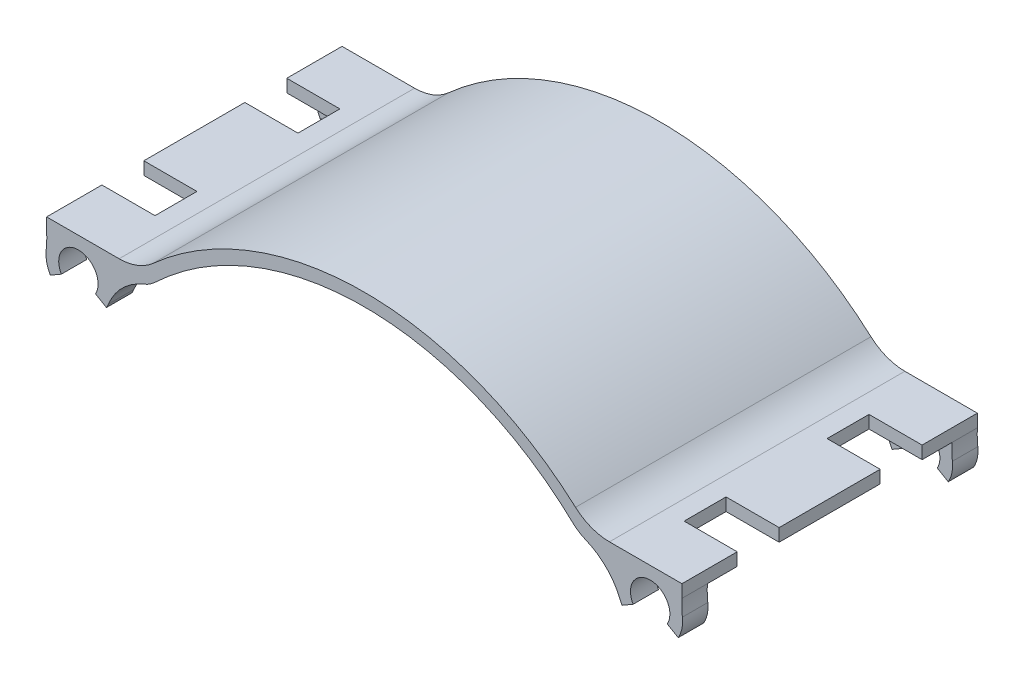
from build123d import *

# Parameters (mm, degrees)
SKETCH3_R             = 5.1
SKETCH3_R_2           = 3.1
BOSS_EXTRUDE2_DEPTH   = 4
BOSS_EXTRUDE2_2_DEPTH = 4
CUT_EXTRUDE1_DEPTH    = 4
BOSS_EXTRUDE3_START   = -23.25
BOSS_EXTRUDE3_DEPTH   = 46.5
SKETCH7_W             = 9.658407056
SKETCH7_H             = 6.6
CUT_EXTRUDE2_DEPTH    = 2
FILLET1_R             = 8
FILLET2_R             = 6
FILLET3_R             = 10
FILLET4_R             = 15


with BuildPart() as part:
    # Sketch3 → Boss-Extrude2 (new body)
    with BuildSketch(Plane.XY):
        with Locations((-116.546102611, -10.445456474)):
            Circle(SKETCH3_R)
        with Locations((-116.546102611, -10.445456474)):
            Circle(SKETCH3_R_2, mode=Mode.SUBTRACT)
    extrude(amount=BOSS_EXTRUDE2_DEPTH)


with BuildPart() as body_2:
    # Sketch3 → Boss-Extrude2 2 (new body)
    with BuildSketch(Plane.XY):
        with Locations(Location((-26.546102611, -10.445456474, 0), (0, 0, 180))):
            Circle(SKETCH3_R)
        with Locations(Location((-26.546102611, -10.445456474, 0), (0, 0, 180))):
            Circle(SKETCH3_R_2, mode=Mode.SUBTRACT)
    extrude(amount=BOSS_EXTRUDE2_2_DEPTH)


with BuildPart() as cut_extrude1_tool:
    # Sketch4 → Cut-Extrude1 (new body)
    with BuildSketch(Plane.XY.offset(4)):
        Polygon((-116.546102611, -10.445456474), (-134.15945469, -20.614530038), (-98.932750532, -20.614530038), align=None)
        Polygon((-26.546102611, -10.445456474), (-8.932750532, -20.614530038), (-44.15945469, -20.614530038), align=None)
    extrude(amount=-CUT_EXTRUDE1_DEPTH)


with BuildPart() as part_1:
    add(part.part)

    # Cut-Extrude1: cut by cut_extrude1_tool
    add(cut_extrude1_tool.part, mode=Mode.SUBTRACT)


with BuildPart() as body_2_1:
    add(body_2.part)

    # Cut-Extrude1: cut by cut_extrude1_tool
    add(cut_extrude1_tool.part, mode=Mode.SUBTRACT)


with BuildPart() as body_3:
    # Mirror2: mirrored copy
    add(part_1.part.mirror(Plane.XY.offset(23.25)))


with BuildPart() as body_4:
    # Mirror2 2: mirrored copy
    add(body_2_1.part.mirror(Plane.XY.offset(23.25)))


with BuildPart() as part_2:
    add(part_1.part)

    add(body_2_1.part)  # Boss-Extrude3 merges body 2

    add(body_3.part)  # Boss-Extrude3 merges body 3

    add(body_4.part)  # Boss-Extrude3 merges body 4
    # Sketch6 → Boss-Extrude3 (add)
    with BuildSketch(Plane.XY.offset(23.25).offset(BOSS_EXTRUDE3_START)):
        with BuildLine():
            Line((-121.546102611, -7.345456474), (-106.100588572, -7.345456474))
            ThreePointArc((-106.100588572, -7.345456474), (-71.546102611, 7.404543526), (-36.99161665, -7.345456474))
            Line((-36.99161665, -7.345456474), (-21.546102611, -7.345456474))
            Line((-21.546102611, -7.345456474), (-21.546102611, -5.345456474))
            Line((-21.546102611, -5.345456474), (-36.148186006, -5.345456474))
            ThreePointArc((-36.148186006, -5.345456474), (-71.546102611, 9.404543526), (-106.944019216, -5.345456474))
            Line((-106.944019216, -5.345456474), (-121.546102611, -5.345456474))
            Line((-121.546102611, -5.345456474), (-121.546102611, -7.345456474))
        make_face()
    extrude(amount=BOSS_EXTRUDE3_DEPTH)

    # Sketch7 → Cut-Extrude2 (cut)
    with BuildSketch(Plane(origin=(0, -5.345456474, 0), x_dir=(1, 0, 0), z_dir=(0, 1, 0))):
        with Locations((-118.016899083, -12)):
            Rectangle(SKETCH7_W, SKETCH7_H)
        with Locations((-118.016899083, -34.5)):
            Rectangle(SKETCH7_W, SKETCH7_H)
        with Locations((-25.075306139, -34.5)):
            Rectangle(SKETCH7_W, SKETCH7_H)
        with Locations((-25.075306139, -12)):
            Rectangle(SKETCH7_W, SKETCH7_H)
    extrude(amount=-CUT_EXTRUDE2_DEPTH, mode=Mode.SUBTRACT)

    # Fillet1
    fillet1_edges = [part_2.edges().sort_by_distance(p)[0] for p in [
        (-36.148186006, -5.345456474, 23.25),
        (-106.944019216, -5.345456474, 23.25),
    ]]
    fillet(fillet1_edges, radius=FILLET1_R)

    # Fillet2
    fillet2_edges = [part_2.edges().sort_by_distance(p)[0] for p in [
        (-106.100588572, -7.345456474, 23.25),
        (-36.99161665, -7.345456474, 23.25),
    ]]
    fillet(fillet2_edges, radius=FILLET2_R)

    # Fillet3
    # the kernel refuses this fillet: 10 mm, written as the material it adds along each edge
    with BuildSketch(Plane(origin=(-112.496411265, -7.345456474, 4), x_dir=(0.9974995155199412, 0.07067330852226088, 0), z_dir=(0, 0, -1)), Plane(origin=(-30.595793957, -7.345456474, 42.5), x_dir=(-0.9974995155199468, 0.07067330852218129, 0), z_dir=(0, 0, 1))) as fillet3_piece_1:
        with BuildLine():
            CenterArc((9.270136929, 9.512895054), FILLET3_R, 206.369759274, 45.673490189)
            Line((0.310673789, 5.07127145), (-0.585272525, 4.62710909))
            ThreePointArc((-0.585272525, 4.62710909), (-0.16632442, 2.555341186), (-0.835029885, 0.550204591))
            Line((-0.835029885, 0.550204591), (0.070673309, -0.997499516))
            ThreePointArc((0.070673309, -0.997499516), (3.983986296, -0.720239455), (5.878847867, -0.951289505))
            Line((5.878847867, -0.951289505), (6.187146873, 0))
        make_face()
    extrude(amount=4)
    with BuildSketch(Plane(origin=(-112.496411265, -7.345456474, 42.5), x_dir=(0.9974995155199412, 0.07067330852226088, 0), z_dir=(0, 0, 1)), Plane(origin=(-30.595793957, -7.345456474, 4), x_dir=(-0.9974995155199468, 0.07067330852218129, 0), z_dir=(0, 0, -1))) as fillet3_piece_2:
        with BuildLine():
            CenterArc((9.270136929, -9.512895054), FILLET3_R, 107.956750537, 45.673490189)
            Line((0.310673789, -5.07127145), (-0.585272525, -4.62710909))
            ThreePointArc((-0.585272525, -4.62710909), (-0.16632442, -2.555341186), (-0.835029885, -0.550204591))
            Line((-0.835029885, -0.550204591), (0.070673309, 0.997499516))
            ThreePointArc((0.070673309, 0.997499516), (3.983986296, 0.720239455), (5.878847867, 0.951289505))
            Line((5.878847867, 0.951289505), (6.187146873, 0))
        make_face()
    extrude(amount=4)

    # Fillet4
    # the kernel refuses this fillet: 15 mm, written as the material it adds along each edge
    with BuildSketch(Plane(origin=(-120.595793957, -7.345456474, 4), x_dir=(-0.37317563120438824, -0.9277607171438153, 0), z_dir=(0, 0, -1)), Plane(origin=(-22.496411265, -7.345456474, 42.5), x_dir=(0.3731756312044104, -0.9277607171438064, 0), z_dir=(0, 0, 1))) as fillet4_piece_1:
        with BuildLine():
            CenterArc((6.743777429, 14.452908836), FILLET4_R, 244.789631476, 9.688258422)
            Line((0.354632032, 0.881659038), (0, 0))
            ThreePointArc((0, 0), (1.364812099, 0.186010996), (2.729624198, 0))
        make_face()
    extrude(amount=4)
    with BuildSketch(Plane(origin=(-120.595793957, -7.345456474, 42.5), x_dir=(-0.37317563120438824, -0.9277607171438153, 0), z_dir=(0, 0, 1))) as fillet4_piece_2:
        with BuildLine():
            CenterArc((6.743777429, -14.452908836), FILLET4_R, 105.522110102, 9.688258422)
            Line((0.354632032, -0.881659038), (0, 0))
            ThreePointArc((0, 0), (1.364812099, -0.186010996), (2.729624198, 0))
        make_face()
    extrude(amount=4)
    with BuildSketch(Plane(origin=(-22.496411265, -7.345456474, 4), x_dir=(1, 0, 0), z_dir=(0, 0, -1))) as fillet4_piece_3:
        with BuildLine():
            CenterArc((15.925454466, 0.863138406), FILLET4_R, 173.610509594, 9.688258422)
            ThreePointArc((1.018629233, 2.532438103), (0.681888311, 1.196804281), (0, 0))
            Line((0, 0), (0.950308654, 0))
        make_face()
    extrude(amount=4)


solid = part_2.part
